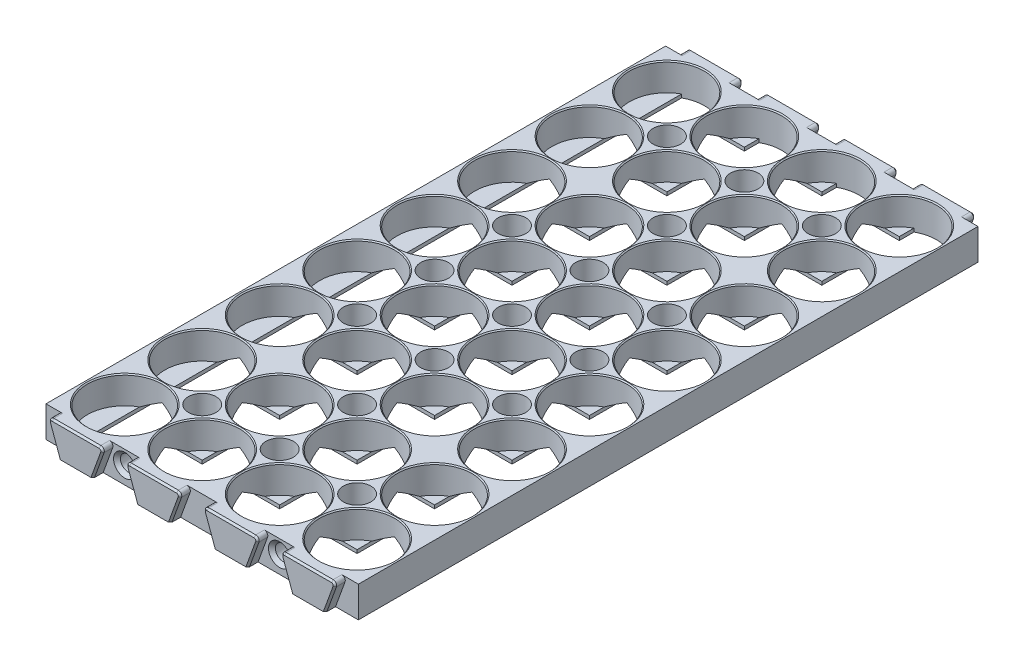
from build123d import *

# Parameters (mm, degrees)
SKETCH1_W                  = 22.5
SKETCH1_H                  = 22.5
SKETCH1_R                  = 10.875
BOSS_EXTRUDE1_DEPTH        = 8
SKETCH2_W                  = 6
SKETCH2_H                  = 6
BOSS_EXTRUDE2_DEPTH        = 1
CHAMFER2_SIZE              = 0.3
LPATTERN1_COUNT            = 8
LPATTERN1_PITCH            = 22.5
LPATTERN1_COUNT_DIR2       = 4
LPATTERN1_PITCH_DIR2       = 22.5
CHAMFER2_OF_LPATTERN1_SIZE = 0.3
SKETCH5_W                  = 6
SKETCH5_H                  = 1
BOSS_EXTRUDE3_DEPTH        = 168
BOSS_EXTRUDE4_START        = 1
BOSS_EXTRUDE4_DEPTH        = 1
CUT_EXTRUDE1_REACH         = 188.392
CUT_EXTRUDE7_REACH         = 188.392
BOSS_EXTRUDE5_DEPTH        = 3
BOSS_EXTRUDE6_DEPTH        = 3
FILLET1_R                  = 1
CHAMFER3_SIZE              = 0.5
SKETCH10_R                 = 2.25
CUT_EXTRUDE2_DEPTH         = 5
CUT_EXTRUDE3_START         = -5
SKETCH11_R                 = 2.25
CUT_EXTRUDE3_DEPTH         = 5
CHAMFER5_SIZE              = 1
SKETCH17_R                 = 4
CUT_EXTRUDE8_DEPTH         = 190.157672327
SKETCH18_R                 = 2.1
CUT_EXTRUDE9_DEPTH         = 4
SKETCH19_R                 = 1.7
CUT_EXTRUDE10_DEPTH        = 7
CHAMFER6_SIZE              = 1
SKETCH22_W                 = 0.375
SKETCH22_H                 = 180
BOSS_EXTRUDE7_DEPTH        = 9
CUT_EXTRUDE11_DEPTH        = 2
CHAMFER7_SIZE              = 0.5


with BuildPart() as part:
    # Sketch1 → Boss-Extrude1 (new body)
    with BuildSketch(Plane(origin=(0, 0, 0), x_dir=(1, 0, 0), z_dir=(0, 1, 0))):
        Rectangle(SKETCH1_W, SKETCH1_H)
        with Locations(Location((0, 0, 0), (0, 0, 270))):
            Circle(SKETCH1_R, mode=Mode.SUBTRACT)
    boss_extrude1 = extrude(amount=BOSS_EXTRUDE1_DEPTH)

    # Sketch2 → Boss-Extrude2 (add)
    with BuildSketch(Plane.XZ):
        with Locations((8.25, 8.25)):
            Rectangle(SKETCH2_W, SKETCH2_H)
        with Locations((8.25, -8.25)):
            Rectangle(SKETCH2_W, SKETCH2_H)
        with Locations((-8.25, -8.25)):
            Rectangle(SKETCH2_W, SKETCH2_H)
        with Locations((-8.25, 8.25)):
            Rectangle(SKETCH2_W, SKETCH2_H)
    boss_extrude2 = extrude(amount=BOSS_EXTRUDE2_DEPTH)

    # Chamfer2
    chamfer2_edges = [part.edges().sort_by_distance(p)[0] for p in [
        (0, 8, -10.875),
    ]]
    chamfer(chamfer2_edges, length=CHAMFER2_SIZE)

    # LPattern1: Boss-Extrude1, Boss-Extrude2 8 × 4
    with Locations(*[(j * LPATTERN1_PITCH_DIR2, 0, i * LPATTERN1_PITCH) for i in range(LPATTERN1_COUNT) for j in range(LPATTERN1_COUNT_DIR2) if (i, j) != (0, 0)]):
        add(boss_extrude1)
        add(boss_extrude2)

    # Chamfer2 of LPattern1
    chamfer2_of_lpattern1_edges = [part.edges().sort_by_distance(p)[0] for p in [
        (22.5, 8, -10.875),
        (45, 8, -10.875),
        (67.5, 8, -10.875),
        (0, 8, 11.625),
        (22.5, 8, 11.625),
        (45, 8, 11.625),
        (67.5, 8, 11.625),
        (0, 8, 34.125),
        (22.5, 8, 34.125),
        (45, 8, 34.125),
        (67.5, 8, 34.125),
        (0, 8, 56.625),
        (22.5, 8, 56.625),
        (45, 8, 56.625),
        (67.5, 8, 56.625),
        (0, 8, 79.125),
        (22.5, 8, 79.125),
        (45, 8, 79.125),
        (67.5, 8, 79.125),
        (0, 8, 101.625),
        (22.5, 8, 101.625),
        (45, 8, 101.625),
        (67.5, 8, 101.625),
        (0, 8, 124.125),
        (22.5, 8, 124.125),
        (45, 8, 124.125),
        (67.5, 8, 124.125),
        (0, 8, 146.625),
        (22.5, 8, 146.625),
        (45, 8, 146.625),
        (67.5, 8, 146.625),
    ]]
    chamfer(chamfer2_of_lpattern1_edges, length=CHAMFER2_OF_LPATTERN1_SIZE)

    # Sketch5 → Boss-Extrude3 (add)
    with BuildSketch(Plane.XY.offset(-5.25)):
        with Locations((-8.25, -0.5)):
            Rectangle(SKETCH5_W, SKETCH5_H)
        Polygon((72.75, -1), (72.75, 0), (77.023818824, 0), (78.75, 0), (78.75, -1), align=None)
    extrude(amount=BOSS_EXTRUDE3_DEPTH)

    # Sketch6 → Boss-Extrude4 (add)
    with BuildSketch(Plane.XZ.offset(BOSS_EXTRUDE4_START)):
        with BuildLine():
            Line((62.25, -11.25), (72.75, -11.25))
            Line((72.75, -11.25), (72.75, -9.523818824))
            ThreePointArc((72.75, -9.523818824), (67.5, -10.875), (62.25, -9.523818824))
            Line((62.25, -9.523818824), (62.25, -11.25))
        make_face()
        with BuildLine():
            Line((39.75, -11.25), (50.25, -11.25))
            Line((50.25, -11.25), (50.25, -9.523818824))
            ThreePointArc((50.25, -9.523818824), (45, -10.875), (39.75, -9.523818824))
            Line((39.75, -9.523818824), (39.75, -11.25))
        make_face()
        with BuildLine():
            Line((17.25, -9.523818824), (17.25, -11.25))
            Line((17.25, -11.25), (27.75, -11.25))
            Line((27.75, -11.25), (27.75, -9.523818824))
            ThreePointArc((27.75, -9.523818824), (22.5, -10.875), (17.25, -9.523818824))
        make_face()
        with BuildLine():
            Line((-5.25, -9.523818824), (-5.25, -11.25))
            Line((-5.25, -11.25), (5.25, -11.25))
            Line((5.25, -11.25), (5.25, -9.523818824))
            ThreePointArc((5.25, -9.523818824), (0, -10.875), (-5.25, -9.523818824))
        make_face()
        with BuildLine():
            Line((5.25, 168.75), (-5.25, 168.75))
            Line((-5.25, 168.75), (-5.25, 167.023818824))
            ThreePointArc((-5.25, 167.023818824), (0, 168.375), (5.25, 167.023818824))
            Line((5.25, 167.023818824), (5.25, 168.75))
        make_face()
        with BuildLine():
            Line((27.75, 167.023818824), (27.75, 168.75))
            Line((27.75, 168.75), (17.25, 168.75))
            Line((17.25, 168.75), (17.25, 167.023818824))
            ThreePointArc((17.25, 167.023818824), (22.5, 168.375), (27.75, 167.023818824))
        make_face()
        with BuildLine():
            Line((72.75, 167.023818824), (72.75, 168.75))
            Line((72.75, 168.75), (62.25, 168.75))
            Line((62.25, 168.75), (62.25, 167.023818824))
            ThreePointArc((62.25, 167.023818824), (67.5, 168.375), (72.75, 167.023818824))
        make_face()
        with BuildLine():
            Line((50.25, 167.023818824), (50.25, 168.75))
            Line((50.25, 168.75), (39.75, 168.75))
            Line((39.75, 168.75), (39.75, 167.023818824))
            ThreePointArc((39.75, 167.023818824), (45, 168.375), (50.25, 167.023818824))
        make_face()
    extrude(amount=-BOSS_EXTRUDE4_DEPTH)

    # Cut-Extrude1: up to this face of the body (flat: up to its plane)
    cut_extrude1_end = Plane(part.part.faces().sort_by_distance((56.25, -0.5, 162.75))[0])
    # Sketch7 → Cut-Extrude1 (cut, up to the picked face)
    with BuildSketch(Plane.XY, mode=Mode.PRIVATE) as cut_extrude1_sk1:
        Polygon((-5.25, 0), (5.25, 0), (0, 3.031088913), align=None)
    cut_extrude1_tool1 = split(extrude(cut_extrude1_sk1.sketch, amount=CUT_EXTRUDE1_REACH, mode=Mode.PRIVATE), bisect_by=cut_extrude1_end, keep=Keep.BOTH, mode=Mode.PRIVATE)
    # Sketch7 → Cut-Extrude1 (cut, up to the picked face)
    with BuildSketch(Plane.XY, mode=Mode.PRIVATE) as cut_extrude1_sk2:
        Polygon((17.25, 0), (22.5, 3.031088913), (27.75, 0), align=None)
    cut_extrude1_tool2 = split(extrude(cut_extrude1_sk2.sketch, amount=CUT_EXTRUDE1_REACH, mode=Mode.PRIVATE), bisect_by=cut_extrude1_end, keep=Keep.BOTH, mode=Mode.PRIVATE)
    # Sketch7 → Cut-Extrude1 (cut, up to the picked face)
    with BuildSketch(Plane.XY, mode=Mode.PRIVATE) as cut_extrude1_sk3:
        Polygon((39.75, 0), (45, 3.031088913), (50.25, 0), align=None)
    cut_extrude1_tool3 = split(extrude(cut_extrude1_sk3.sketch, amount=CUT_EXTRUDE1_REACH, mode=Mode.PRIVATE), bisect_by=cut_extrude1_end, keep=Keep.BOTH, mode=Mode.PRIVATE)
    # Sketch7 → Cut-Extrude1 (cut, up to the picked face)
    with BuildSketch(Plane.XY, mode=Mode.PRIVATE) as cut_extrude1_sk4:
        Polygon((62.25, 0), (67.5, 3.031088913), (72.75, 0), align=None)
    cut_extrude1_tool4 = split(extrude(cut_extrude1_sk4.sketch, amount=CUT_EXTRUDE1_REACH, mode=Mode.PRIVATE), bisect_by=cut_extrude1_end, keep=Keep.BOTH, mode=Mode.PRIVATE)
    add(cut_extrude1_tool1.solids().sort_by(Axis((0, 1.010363, 0), (0, 0, 1)))[0], mode=Mode.SUBTRACT)
    add(cut_extrude1_tool2.solids().sort_by(Axis((22.5, 1.010363, 0), (0, 0, 1)))[0], mode=Mode.SUBTRACT)
    add(cut_extrude1_tool3.solids().sort_by(Axis((45, 1.010363, 0), (0, 0, 1)))[0], mode=Mode.SUBTRACT)
    add(cut_extrude1_tool4.solids().sort_by(Axis((67.5, 1.010363, 0), (0, 0, 1)))[0], mode=Mode.SUBTRACT)

    # Cut-Extrude7: up to this face of the body (flat: up to its plane)
    cut_extrude7_end = Plane(part.part.faces().sort_by_distance((62.25, -0.5, 11.25))[0])
    # Sketch16 → Cut-Extrude7 (cut, up to the picked face)
    with BuildSketch(Plane(origin=(0, 0, 0), x_dir=(0, 0, -1), z_dir=(1, 0, 0)), mode=Mode.PRIVATE) as cut_extrude7_sk1:
        Polygon((-5.25, 0), (0, 3.031088913), (5.25, 0), align=None)
    cut_extrude7_tool1 = split(extrude(cut_extrude7_sk1.sketch, amount=CUT_EXTRUDE7_REACH, mode=Mode.PRIVATE), bisect_by=cut_extrude7_end, keep=Keep.BOTH, mode=Mode.PRIVATE)
    # Sketch16 → Cut-Extrude7 (cut, up to the picked face)
    with BuildSketch(Plane(origin=(0, 0, 0), x_dir=(0, 0, -1), z_dir=(1, 0, 0)), mode=Mode.PRIVATE) as cut_extrude7_sk2:
        Polygon((-22.5, 3.031088913), (-17.25, 0), (-27.75, 0), align=None)
    cut_extrude7_tool2 = split(extrude(cut_extrude7_sk2.sketch, amount=CUT_EXTRUDE7_REACH, mode=Mode.PRIVATE), bisect_by=cut_extrude7_end, keep=Keep.BOTH, mode=Mode.PRIVATE)
    # Sketch16 → Cut-Extrude7 (cut, up to the picked face)
    with BuildSketch(Plane(origin=(0, 0, 0), x_dir=(0, 0, -1), z_dir=(1, 0, 0)), mode=Mode.PRIVATE) as cut_extrude7_sk3:
        Polygon((-45, 3.031088913), (-39.75, 0), (-50.25, 0), align=None)
    cut_extrude7_tool3 = split(extrude(cut_extrude7_sk3.sketch, amount=CUT_EXTRUDE7_REACH, mode=Mode.PRIVATE), bisect_by=cut_extrude7_end, keep=Keep.BOTH, mode=Mode.PRIVATE)
    # Sketch16 → Cut-Extrude7 (cut, up to the picked face)
    with BuildSketch(Plane(origin=(0, 0, 0), x_dir=(0, 0, -1), z_dir=(1, 0, 0)), mode=Mode.PRIVATE) as cut_extrude7_sk4:
        Polygon((-67.5, 3.031088913), (-62.25, 0), (-72.75, 0), align=None)
    cut_extrude7_tool4 = split(extrude(cut_extrude7_sk4.sketch, amount=CUT_EXTRUDE7_REACH, mode=Mode.PRIVATE), bisect_by=cut_extrude7_end, keep=Keep.BOTH, mode=Mode.PRIVATE)
    # Sketch16 → Cut-Extrude7 (cut, up to the picked face)
    with BuildSketch(Plane(origin=(0, 0, 0), x_dir=(0, 0, -1), z_dir=(1, 0, 0)), mode=Mode.PRIVATE) as cut_extrude7_sk5:
        Polygon((-90, 3.031088913), (-84.75, 0), (-95.25, 0), align=None)
    cut_extrude7_tool5 = split(extrude(cut_extrude7_sk5.sketch, amount=CUT_EXTRUDE7_REACH, mode=Mode.PRIVATE), bisect_by=cut_extrude7_end, keep=Keep.BOTH, mode=Mode.PRIVATE)
    # Sketch16 → Cut-Extrude7 (cut, up to the picked face)
    with BuildSketch(Plane(origin=(0, 0, 0), x_dir=(0, 0, -1), z_dir=(1, 0, 0)), mode=Mode.PRIVATE) as cut_extrude7_sk6:
        Polygon((-112.5, 3.031088913), (-107.25, 0), (-117.75, 0), align=None)
    cut_extrude7_tool6 = split(extrude(cut_extrude7_sk6.sketch, amount=CUT_EXTRUDE7_REACH, mode=Mode.PRIVATE), bisect_by=cut_extrude7_end, keep=Keep.BOTH, mode=Mode.PRIVATE)
    # Sketch16 → Cut-Extrude7 (cut, up to the picked face)
    with BuildSketch(Plane(origin=(0, 0, 0), x_dir=(0, 0, -1), z_dir=(1, 0, 0)), mode=Mode.PRIVATE) as cut_extrude7_sk7:
        Polygon((-135, 3.031088913), (-129.75, 0), (-140.25, 0), align=None)
    cut_extrude7_tool7 = split(extrude(cut_extrude7_sk7.sketch, amount=CUT_EXTRUDE7_REACH, mode=Mode.PRIVATE), bisect_by=cut_extrude7_end, keep=Keep.BOTH, mode=Mode.PRIVATE)
    # Sketch16 → Cut-Extrude7 (cut, up to the picked face)
    with BuildSketch(Plane(origin=(0, 0, 0), x_dir=(0, 0, -1), z_dir=(1, 0, 0)), mode=Mode.PRIVATE) as cut_extrude7_sk8:
        Polygon((-157.5, 3.031088913), (-152.25, 0), (-162.75, 0), align=None)
    cut_extrude7_tool8 = split(extrude(cut_extrude7_sk8.sketch, amount=CUT_EXTRUDE7_REACH, mode=Mode.PRIVATE), bisect_by=cut_extrude7_end, keep=Keep.BOTH, mode=Mode.PRIVATE)
    # Sketch16 → Cut-Extrude7 (cut, up to the picked face)
    with BuildSketch(Plane(origin=(0, 0, 0), x_dir=(0, 0, -1), z_dir=(1, 0, 0)), mode=Mode.PRIVATE) as cut_extrude7_sk9:
        Polygon((-180, 3.031088913), (-174.75, 0), (-185.25, 0), align=None)
    cut_extrude7_tool9 = split(extrude(cut_extrude7_sk9.sketch, amount=CUT_EXTRUDE7_REACH, mode=Mode.PRIVATE), bisect_by=cut_extrude7_end, keep=Keep.BOTH, mode=Mode.PRIVATE)
    # Sketch16 → Cut-Extrude7 (cut, up to the picked face)
    with BuildSketch(Plane(origin=(0, 0, 0), x_dir=(0, 0, -1), z_dir=(1, 0, 0)), mode=Mode.PRIVATE) as cut_extrude7_sk10:
        Polygon((-202.5, 3.031088913), (-197.25, 0), (-207.75, 0), align=None)
    cut_extrude7_tool10 = split(extrude(cut_extrude7_sk10.sketch, amount=CUT_EXTRUDE7_REACH, mode=Mode.PRIVATE), bisect_by=cut_extrude7_end, keep=Keep.BOTH, mode=Mode.PRIVATE)
    # Sketch16 → Cut-Extrude7 (cut, up to the picked face)
    with BuildSketch(Plane(origin=(0, 0, 0), x_dir=(0, 0, -1), z_dir=(1, 0, 0)), mode=Mode.PRIVATE) as cut_extrude7_sk11:
        Polygon((-225, 3.031088913), (-219.75, 0), (-230.25, 0), align=None)
    cut_extrude7_tool11 = split(extrude(cut_extrude7_sk11.sketch, amount=CUT_EXTRUDE7_REACH, mode=Mode.PRIVATE), bisect_by=cut_extrude7_end, keep=Keep.BOTH, mode=Mode.PRIVATE)
    # Sketch16 → Cut-Extrude7 (cut, up to the picked face)
    with BuildSketch(Plane(origin=(0, 0, 0), x_dir=(0, 0, -1), z_dir=(1, 0, 0)), mode=Mode.PRIVATE) as cut_extrude7_sk12:
        Polygon((-247.5, 3.031088913), (-242.25, 0), (-252.75, 0), align=None)
    cut_extrude7_tool12 = split(extrude(cut_extrude7_sk12.sketch, amount=CUT_EXTRUDE7_REACH, mode=Mode.PRIVATE), bisect_by=cut_extrude7_end, keep=Keep.BOTH, mode=Mode.PRIVATE)
    add(cut_extrude7_tool1.solids().sort_by(Axis((0, 1.010363, 0), (1, 0, 0)))[0], mode=Mode.SUBTRACT)
    add(cut_extrude7_tool2.solids().sort_by(Axis((0, 1.010363, 22.5), (1, 0, 0)))[0], mode=Mode.SUBTRACT)
    add(cut_extrude7_tool3.solids().sort_by(Axis((0, 1.010363, 45), (1, 0, 0)))[0], mode=Mode.SUBTRACT)
    add(cut_extrude7_tool4.solids().sort_by(Axis((0, 1.010363, 67.5), (1, 0, 0)))[0], mode=Mode.SUBTRACT)
    add(cut_extrude7_tool5.solids().sort_by(Axis((0, 1.010363, 90), (1, 0, 0)))[0], mode=Mode.SUBTRACT)
    add(cut_extrude7_tool6.solids().sort_by(Axis((0, 1.010363, 112.5), (1, 0, 0)))[0], mode=Mode.SUBTRACT)
    add(cut_extrude7_tool7.solids().sort_by(Axis((0, 1.010363, 135), (1, 0, 0)))[0], mode=Mode.SUBTRACT)
    add(cut_extrude7_tool8.solids().sort_by(Axis((0, 1.010363, 157.5), (1, 0, 0)))[0], mode=Mode.SUBTRACT)
    add(cut_extrude7_tool9.solids().sort_by(Axis((0, 1.010363, 180), (1, 0, 0)))[0], mode=Mode.SUBTRACT)
    add(cut_extrude7_tool10.solids().sort_by(Axis((0, 1.010363, 202.5), (1, 0, 0)))[0], mode=Mode.SUBTRACT)
    add(cut_extrude7_tool11.solids().sort_by(Axis((0, 1.010363, 225), (1, 0, 0)))[0], mode=Mode.SUBTRACT)
    add(cut_extrude7_tool12.solids().sort_by(Axis((0, 1.010363, 247.5), (1, 0, 0)))[0], mode=Mode.SUBTRACT)

    # Sketch8 → Boss-Extrude5 (add)
    with BuildSketch(Plane(origin=(0, 0, -11.25), x_dir=(-1, 0, 0), z_dir=(0, 0, -1))):
        Polygon((-27.474267892, -1), (-30.75, 8), (-14.25, 8), (-17.525732108, -1), align=None)
        Polygon((4.974267892, -1), (-4.974267892, -1), (-8.25, 8), (8.25, 8), align=None)
        Polygon((-49.974267892, -1), (-53.25, 8), (-36.75, 8), (-40.025732108, -1), align=None)
        Polygon((-72.474267892, -1), (-75.75, 8), (-59.25, 8), (-62.525732108, -1), align=None)
    extrude(amount=BOSS_EXTRUDE5_DEPTH)

    # Sketch9 → Boss-Extrude6 (add)
    with BuildSketch(Plane.XY.offset(168.75)):
        Polygon((-4.974267892, -1), (4.974267892, -1), (8.25, 8), (-8.25, 8), align=None)
        Polygon((72.474267892, -1), (75.75, 8), (59.25, 8), (62.525732108, -1), align=None)
        Polygon((49.974267892, -1), (53.25, 8), (36.75, 8), (40.025732108, -1), align=None)
        Polygon((14.25, 8), (17.525732108, -1), (27.474267892, -1), (30.75, 8), align=None)
    extrude(amount=BOSS_EXTRUDE6_DEPTH)

    # Fillet1
    fillet1_edges = [part.edges().sort_by_distance(p)[0] for p in [
        (-8.25, 8, -12.75),
        (8.25, 8, -12.75),
        (14.25, 8, -12.75),
        (30.75, 8, -12.75),
        (36.75, 8, -12.75),
        (53.25, 8, -12.75),
        (59.25, 8, -12.75),
        (75.75, 8, -12.75),
        (-8.25, 8, 170.25),
        (8.25, 8, 170.25),
        (75.75, 8, 170.25),
        (59.25, 8, 170.25),
        (53.25, 8, 170.25),
        (36.75, 8, 170.25),
        (30.75, 8, 170.25),
        (14.25, 8, 170.25),
    ]]
    fillet(fillet1_edges, radius=FILLET1_R)

    # Chamfer3
    chamfer3_edges = [part.edges().sort_by_distance(p)[0] for p in [
        (-6.367906253, 2.828989928, -14.25),
        (16.132093747, 2.828989928, -14.25),
        (38.632093747, 2.828989928, -14.25),
        (61.132093747, 2.828989928, -14.25),
        (6.367906253, 2.828989928, 171.75),
        (73.867906253, 2.828989928, 171.75),
        (51.367906253, 2.828989928, 171.75),
        (28.867906253, 2.828989928, 171.75),
        (67.5, 8, -14.25),
        (45, 8, -14.25),
        (22.5, 8, -14.25),
        (0, 8, -14.25),
        (0, 8, 171.75),
        (22.5, 8, 171.75),
        (45, 8, 171.75),
        (67.5, 8, 171.75),
        (28.867906253, 2.828989928, -14.25),
        (30.141004038, 7.573576436, -14.25),
        (14.858995962, 7.573576436, -14.25),
        (6.367906253, 2.828989928, -14.25),
        (-7.641004038, 7.573576436, -14.25),
        (7.641004038, 7.573576436, -14.25),
        (73.867906253, 2.828989928, -14.25),
        (75.141004038, 7.573576436, -14.25),
        (59.858995962, 7.573576436, -14.25),
        (51.367906253, 2.828989928, -14.25),
        (37.358995962, 7.573576436, -14.25),
        (52.641004038, 7.573576436, -14.25),
        (-6.367906253, 2.828989928, 171.75),
        (7.641004038, 7.573576436, 171.75),
        (-7.641004038, 7.573576436, 171.75),
        (16.132093747, 2.828989928, 171.75),
        (30.141004038, 7.573576436, 171.75),
        (14.858995962, 7.573576436, 171.75),
        (38.632093747, 2.828989928, 171.75),
        (52.641004038, 7.573576436, 171.75),
        (37.358995962, 7.573576436, 171.75),
        (61.132093747, 2.828989928, 171.75),
        (75.141004038, 7.573576436, 171.75),
        (59.858995962, 7.573576436, 171.75),
    ]]
    chamfer(chamfer3_edges, length=CHAMFER3_SIZE)

    # Sketch10 → Cut-Extrude2 (cut)
    with BuildSketch(Plane(origin=(0, 0, -11.25), x_dir=(-1, 0, 0), z_dir=(0, 0, -1))):
        with Locations((-11.25, 4)):
            Circle(SKETCH10_R)
        with Locations(Location((-56.25, 4, 0), (0, 0, 180))):
            Circle(SKETCH10_R)
    extrude(amount=-CUT_EXTRUDE2_DEPTH, mode=Mode.SUBTRACT)

    # Sketch11 → Cut-Extrude3 (cut)
    with BuildSketch(Plane.XY.offset(168.75).offset(CUT_EXTRUDE3_START)):
        with Locations(Location((11.25, 4, 0), (0, 0, 180))):
            Circle(SKETCH11_R)
        with Locations((56.25, 4)):
            Circle(SKETCH11_R)
    extrude(amount=CUT_EXTRUDE3_DEPTH, mode=Mode.SUBTRACT)

    # Chamfer5
    chamfer5_edges = [part.edges().sort_by_distance(p)[0] for p in [
        (54, 4, -11.25),
        (13.5, 4, -11.25),
        (13.5, 4, 168.75),
        (54, 4, 168.75),
    ]]
    chamfer(chamfer5_edges, length=CHAMFER5_SIZE)

    # Sketch17 → Cut-Extrude8 (cut, through all)
    with BuildSketch(Plane.XZ.offset(1)):
        with Locations(Location((11.25, 11.25, 0), (0, 0, 270))):
            Circle(SKETCH17_R)
        with Locations(Location((33.75, 11.25, 0), (0, 0, 270))):
            Circle(SKETCH17_R)
        with Locations(Location((56.25, 11.25, 0), (0, 0, 270))):
            Circle(SKETCH17_R)
        with Locations((11.25, 258.75)):
            Circle(SKETCH17_R)
        with Locations((33.75, 258.75)):
            Circle(SKETCH17_R)
        with Locations((56.25, 258.75)):
            Circle(SKETCH17_R)
        with Locations((11.25, 281.25)):
            Circle(SKETCH17_R)
        with Locations((33.75, 281.25)):
            Circle(SKETCH17_R)
        with Locations((56.25, 281.25)):
            Circle(SKETCH17_R)
        with Locations(Location((33.75, 33.75, 0), (0, 0, 270))):
            Circle(SKETCH17_R)
        with Locations(Location((11.25, 56.25, 0), (0, 0, 270))):
            Circle(SKETCH17_R)
        with Locations(Location((33.75, 56.25, 0), (0, 0, 270))):
            Circle(SKETCH17_R)
        with Locations(Location((56.25, 56.25, 0), (0, 0, 270))):
            Circle(SKETCH17_R)
        with Locations(Location((11.25, 78.75, 0), (0, 0, 270))):
            Circle(SKETCH17_R)
        with Locations(Location((33.75, 78.75, 0), (0, 0, 270))):
            Circle(SKETCH17_R)
        with Locations(Location((56.25, 78.75, 0), (0, 0, 270))):
            Circle(SKETCH17_R)
        with Locations(Location((11.25, 101.25, 0), (0, 0, 270))):
            Circle(SKETCH17_R)
        with Locations(Location((33.75, 101.25, 0), (0, 0, 270))):
            Circle(SKETCH17_R)
        with Locations(Location((56.25, 101.25, 0), (0, 0, 270))):
            Circle(SKETCH17_R)
        with Locations(Location((33.75, 123.75, 0), (0, 0, 270))):
            Circle(SKETCH17_R)
        with Locations(Location((11.25, 146.25, 0), (0, 0, 270))):
            Circle(SKETCH17_R)
        with Locations(Location((33.75, 146.25, 0), (0, 0, 270))):
            Circle(SKETCH17_R)
        with Locations(Location((56.25, 146.25, 0), (0, 0, 270))):
            Circle(SKETCH17_R)
    extrude(amount=-CUT_EXTRUDE8_DEPTH, mode=Mode.SUBTRACT)

    # Sketch18 → Cut-Extrude9 (cut)
    with BuildSketch(Plane.XZ.offset(1)):
        with Locations(Location((11.25, 33.75, 0), (0, 0, 270))):
            Circle(SKETCH18_R)
        with Locations(Location((56.25, 33.75, 0), (0, 0, 270))):
            Circle(SKETCH18_R)
        with Locations(Location((56.25, 123.75, 0), (0, 0, 270))):
            Circle(SKETCH18_R)
        with Locations(Location((11.25, 123.75, 0), (0, 0, 270))):
            Circle(SKETCH18_R)
    extrude(amount=-CUT_EXTRUDE9_DEPTH, mode=Mode.SUBTRACT)

    # Sketch19 → Cut-Extrude10 (cut)
    with BuildSketch(Plane.XZ.offset(1)):
        with Locations(Location((56.25, 123.75, 0), (0, 0, 270))):
            Circle(SKETCH19_R)
        with Locations(Location((11.25, 33.75, 0), (0, 0, 270))):
            Circle(SKETCH19_R)
        with Locations(Location((11.25, 123.75, 0), (0, 0, 270))):
            Circle(SKETCH19_R)
        with Locations(Location((56.25, 33.75, 0), (0, 0, 270))):
            Circle(SKETCH19_R)
    extrude(amount=-CUT_EXTRUDE10_DEPTH, mode=Mode.SUBTRACT)

    # Chamfer6
    chamfer6_edges = [part.edges().sort_by_distance(p)[0] for p in [
        (11.25, -1, 125.85),
        (56.25, -1, 125.85),
        (56.25, -1, 35.85),
        (11.25, -1, 35.85),
    ]]
    chamfer(chamfer6_edges, length=CHAMFER6_SIZE)

    # Sketch22 → Boss-Extrude7 (add)
    with BuildSketch(Plane(origin=(0, 8, 0), x_dir=(1, 0, 0), z_dir=(0, 1, 0))):
        with Locations((-11.4375, -78.75)):
            Rectangle(SKETCH22_W, SKETCH22_H)
        with Locations((78.9375, -78.75)):
            Rectangle(SKETCH22_W, SKETCH22_H)
    extrude(amount=-BOSS_EXTRUDE7_DEPTH)

    # Sketch14 → Cut-Extrude11 (cut)
    with BuildSketch(Plane.XZ.offset(1)):
        Polygon((-10.25, 76.294119063), (-10.25, 81.205880937), (-6.25, 79.75), (-6.25, 77.75), align=None)
        Polygon((-6.25, 10.25), (-6.25, 12.25), (-10.25, 13.705880937), (-10.25, 8.794119063), align=None)
        Polygon((-10.25, 148.705880937), (-6.25, 147.25), (-6.25, 145.25), (-10.25, 143.794119063), align=None)
        Polygon((77.75, 76.294119063), (73.75, 77.75), (73.75, 79.75), (77.75, 81.205880937), align=None)
        Polygon((77.75, 8.794119063), (73.75, 10.25), (73.75, 12.25), (77.75, 13.705880937), align=None)
        Polygon((73.75, 147.25), (73.75, 145.25), (77.75, 143.794119063), (77.75, 148.705880937), align=None)
    extrude(amount=-CUT_EXTRUDE11_DEPTH, mode=Mode.SUBTRACT)

    # Chamfer7
    chamfer7_edges = [part.edges().sort_by_distance(p)[0] for p in [
        (-8.25, -1, 80.477940469),
        (-10.25, -1, 78.75),
        (-8.25, -1, 77.022059531),
        (-6.25, -1, 78.75),
        (-10.25, -1, 146.25),
        (-8.25, -1, 144.522059531),
        (-6.25, -1, 146.25),
        (-8.25, -1, 147.977940469),
        (77.75, -1, 78.75),
        (75.75, -1, 80.477940469),
        (73.75, -1, 78.75),
        (75.75, -1, 77.022059531),
        (77.75, -1, 11.25),
        (75.75, -1, 12.977940469),
        (73.75, -1, 11.25),
        (75.75, -1, 9.522059531),
        (75.75, -1, 147.977940469),
        (73.75, -1, 146.25),
        (75.75, -1, 144.522059531),
        (77.75, -1, 146.25),
        (-8.25, -1, 12.977940469),
        (-10.25, -1, 11.25),
        (-8.25, -1, 9.522059531),
        (-6.25, -1, 11.25),
    ]]
    chamfer(chamfer7_edges, length=CHAMFER7_SIZE)


solid = part.part
